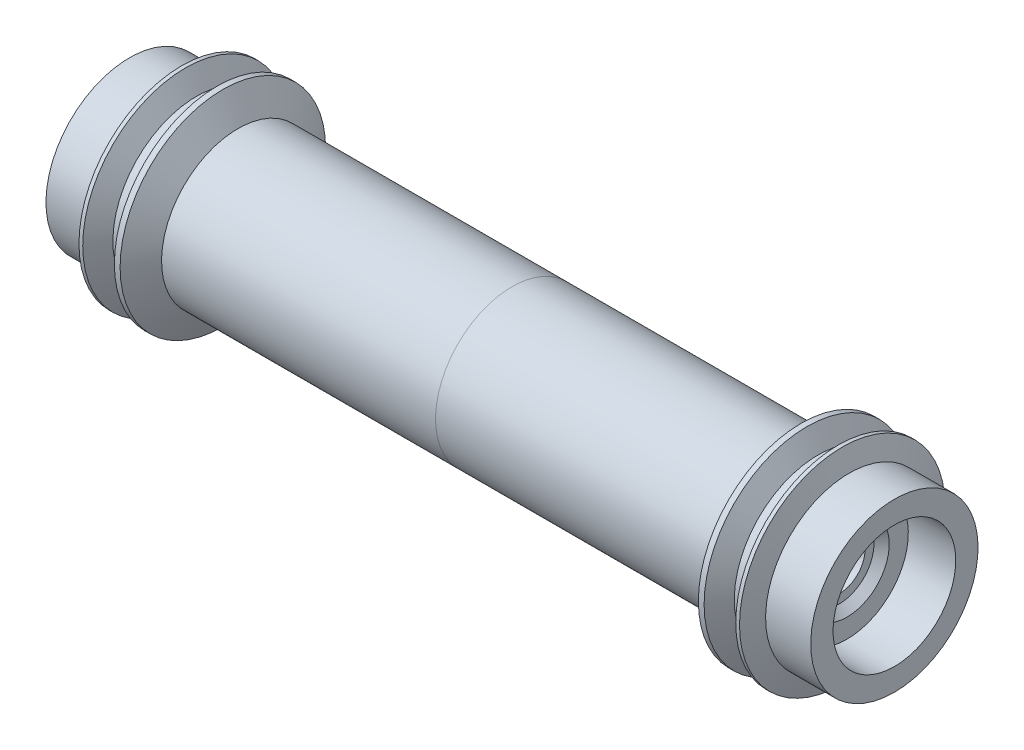
from build123d import *

# Parameters (mm, degrees)
CHAMFER1_SIZE = 0.508


with BuildPart() as part:
    # Sketch2 → Revolve1 (revolve)
    with BuildSketch(Plane.XY):
        Polygon((-22.4, 5.55625), (-25.4, 5.55625), (-25.4, 4.075), (-22.25, 4.075), (-22.25, 2.805), (-21.742, 2.297), (-21.742, 1.7145), (-15.575, 1.7145), (-15.575, 0), (-14.1, 0), (-12.5, 1.6), (0, 1.6), (0, 5.08), (-18.197567251, 5.08), (-19.205765158, 6.82625), (-19.586765158, 6.82625), (-20.32, 5.55625), (-20.955, 5.55625), (-21.688234842, 6.82625), (-21.937757802, 6.82625), align=None)
    revolve(axis=Axis((-25.4, 0, 0), (1, 0, 0)))


with BuildPart() as body_2:
    # Mirror1: mirrored copy
    add(part.part.mirror(Plane(origin=(0, 0, 0), x_dir=(0, 0, 1), z_dir=(1, 0, 0))))


with BuildPart() as part_1:
    add(part.part)

    # Chamfer1
    chamfer1_edges = [part_1.edges().sort_by_distance(p)[0] for p in [
        (-25.4, -4.075, 0),
    ]]
    chamfer(chamfer1_edges, length=CHAMFER1_SIZE)


solid = Compound([body_2.part, part_1.part])
